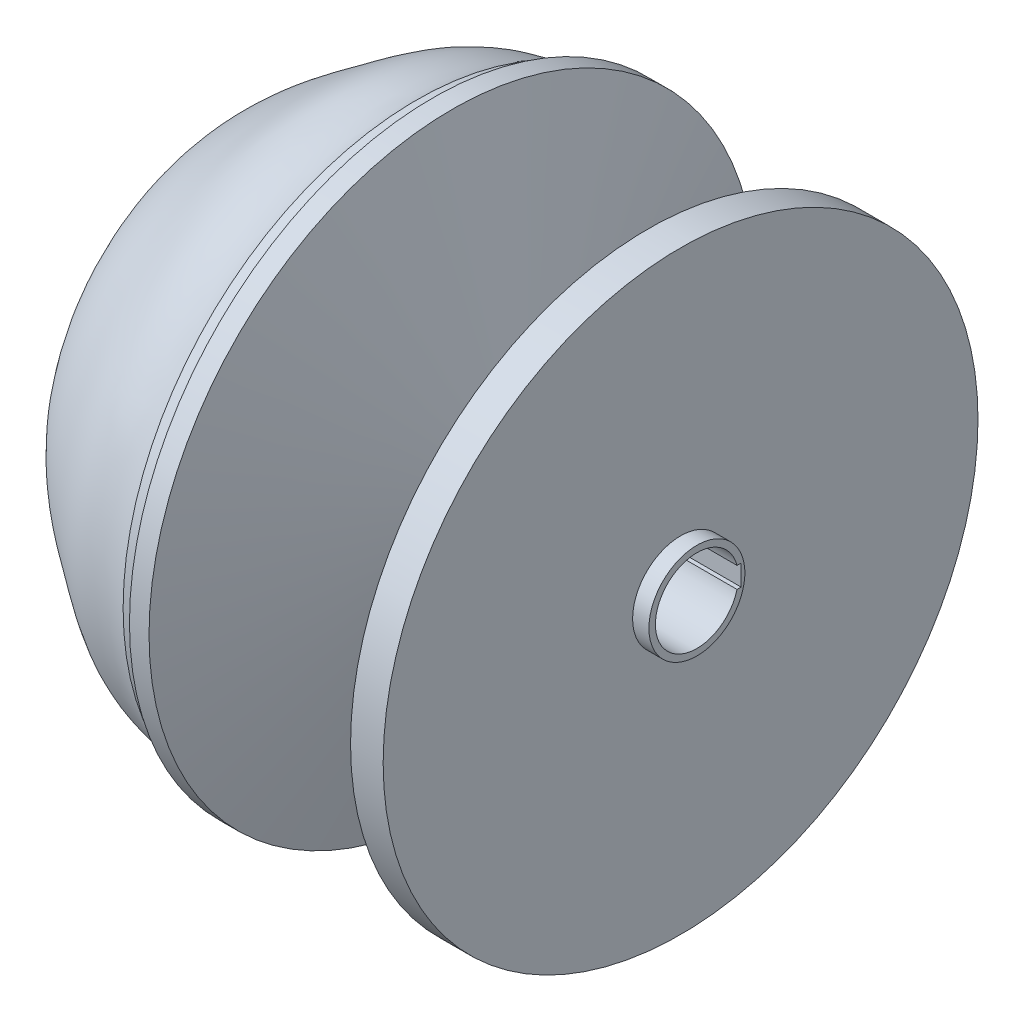
from build123d import *

# Parameters (mm, degrees)
SKETCH2_R          = 12.718
CUT_EXTRUDE1_DEPTH = 82.74
SKETCH3_R          = 10
CUT_EXTRUDE2_DEPTH = 79.507
SKETCH4_W          = 1.691
SKETCH4_H          = 6.375
CUT_EXTRUDE3_DEPTH = 56


with BuildPart() as part:
    # Sketch1 → Revolve1 (revolve)
    with BuildSketch(Plane.XY, mode=Mode.PRIVATE) as revolve1_sk:
        with BuildLine():
            Line((-80.911998208, 0), (-80.911998208, 12.718))
            Line((-80.911998208, 12.718), (-70.911998208, 12.718))
            Line((-70.911998208, 12.718), (-70.911998208, 32.718))
            add(Edge.make_bspline(
                [(-70.911998208, 32.718), (-72.296532146, 50.185235542), (-58.681197048, 63.170292577), (-38.636582778, 76.893357171), (-26.258344783, 86.831311493), (-12.152126662, 86.899446164), (-6.607628807, 90)],
                knots=[0, 0, 0, 0, 0.504233074, 0.563304469, 0.79660287, 1, 1, 1, 1], degree=3))
            Line((-6.607628807, 90), (-1.664998208, 90))
            Line((-1.664998208, 90), (-1.664998208, 93))
            Line((-1.664998208, 93), (4.335001792, 93))
            Line((4.335001792, 93), (23.827899809, 15))
            Line((23.827899809, 15), (48.827899809, 15))
            Line((48.827899809, 15), (64.335001792, 91.202154094))
            Line((64.335001792, 91.202154094), (74.335001792, 91.202154094))
            Line((74.335001792, 91.202154094), (74.335001792, 14.709294291))
            Line((74.335001792, 14.709294291), (79.335001792, 14.709294291))
            Line((79.335001792, 14.709294291), (79.335001792, 0))
            Line((79.335001792, 0), (-80.911998208, 0))
        make_face()
    revolve(revolve1_sk.sketch.rotate(Axis((-81.835688806, 0, 0), (1, 0, 0)), 90), axis=Axis((-81.835688806, 0, 0), (1, 0, 0)))

    # Sketch2 → Cut-Extrude1 (cut)
    with BuildSketch(Plane(origin=(79.335001792, 0, 0), x_dir=(0, 0, -1), z_dir=(1, 0, 0))):
        with Locations(Location((0, 0, 0), (0, 0, 180))):
            Circle(SKETCH2_R)
    extrude(amount=-CUT_EXTRUDE1_DEPTH, mode=Mode.SUBTRACT)

    # Sketch3 → Cut-Extrude2 (cut)
    with BuildSketch(Plane.ZY.offset(80.911998208)):
        Circle(SKETCH3_R)
    extrude(amount=-CUT_EXTRUDE2_DEPTH, mode=Mode.SUBTRACT)

    # Chamfer1
    # the kernel refuses this chamfer: 3, 1.732050808 mm, written as the material it takes off along each edge
    with BuildSketch(Plane(origin=(-3.404998208, 0, 0), x_dir=(0, 0, 1), z_dir=(0, -1, 0))) as chamfer1_piece_1_section:
        with BuildLine():
            Line((9.896076952, 1.792050808), (13.103923048, -0.06))
            Line((13.103923048, -0.06), (13.103923048, -0.12))
            ThreePointArc((13.103923048, -0.12), (11.551961524, -0.06), (10, -0.06))
            Line((10, -0.06), (9.94, 0))
            ThreePointArc((9.94, 0), (9.94, 0.896025404), (9.836076952, 1.792050808))
            Line((9.836076952, 1.792050808), (9.896076952, 1.792050808))
        make_face()
    chamfer1_piece_1 = revolve(axis=Axis((-3.404998208, 0, 0), (-1, 0, 0)), mode=Mode.PRIVATE)
    chamfer1_piece_1 = chamfer1_piece_1 & Plane(origin=(-4.331873762, 0, 0), x_dir=(0, 0, 1), z_dir=(1, 0, 0)) * Cylinder(12.718, 53, mode=Mode.PRIVATE)
    add(chamfer1_piece_1, mode=Mode.SUBTRACT)

    # Sketch4 → Cut-Extrude3 (cut)
    with BuildSketch(Plane(origin=(79.335001792, 0, 0), x_dir=(0, 0, -1), z_dir=(1, 0, 0))):
        with Locations((12.718, 0)):
            Rectangle(SKETCH4_W, SKETCH4_H)
    extrude(amount=-CUT_EXTRUDE3_DEPTH, mode=Mode.SUBTRACT)


solid = part.part
